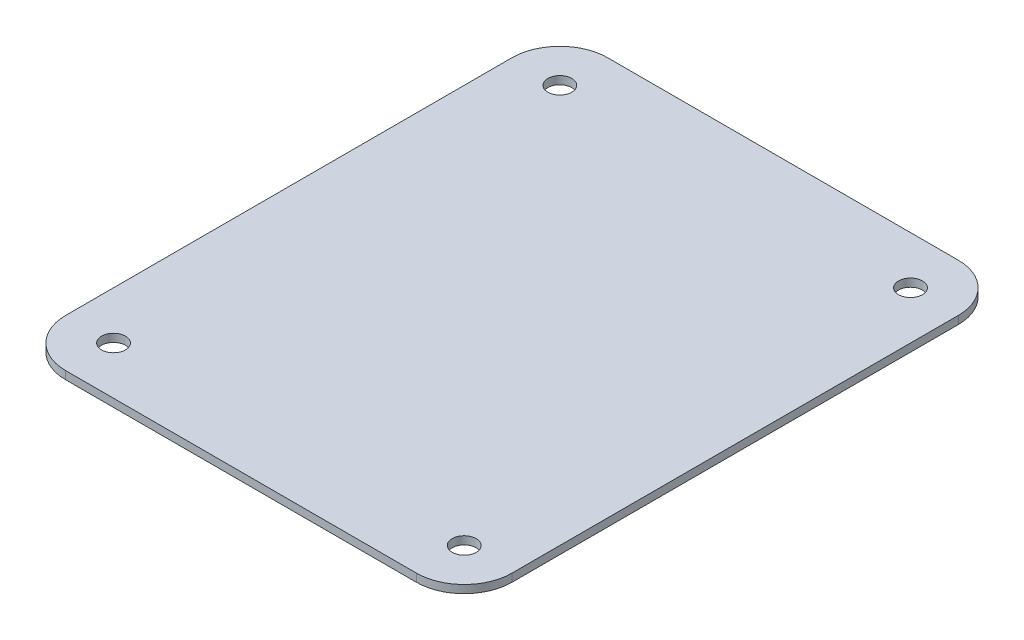
from build123d import *

# Parameters (mm, degrees)
BASE_FLANGE1_DEPTH = 3.175
SKETCH6_R          = 4.7625
CUT_EXTRUDE1_DEPTH = 140.880281402


# Sheet-metal steps are written as plain solids
with BuildPart() as part:
    # Sketch1 → Base-Flange1 (new body)
    with BuildSketch(Plane(origin=(0, 0, 0), x_dir=(1, 0, 0), z_dir=(0, 1, 0))):
        with BuildLine():
            Line((-69.85, -107.95), (69.85, -107.95))
            ThreePointArc((69.85, -107.95), (83.320384182, -102.370384182), (88.9, -88.9))
            Line((88.9, -88.9), (88.9, 88.9))
            ThreePointArc((88.9, 88.9), (83.320384182, 102.370384182), (69.85, 107.95))
            Line((69.85, 107.95), (-69.85, 107.95))
            ThreePointArc((-69.85, 107.95), (-83.320384182, 102.370384182), (-88.9, 88.9))
            Line((-88.9, 88.9), (-88.9, -88.9))
            ThreePointArc((-88.9, -88.9), (-83.320384182, -102.370384182), (-69.85, -107.95))
        make_face()
    extrude(amount=-BASE_FLANGE1_DEPTH)

    # Sketch6 → Cut-Extrude1 (cut, through all)
    with BuildSketch(Plane(origin=(0, 0, 0), x_dir=(1, 0, 0), z_dir=(0, 1, 0))):
        with Locations(Location((-69.85, -88.9, 0), (0, 0, 270))):
            Circle(SKETCH6_R)
        with Locations(Location((69.85, -88.9, 0), (0, 0, 270))):
            Circle(SKETCH6_R)
        with Locations(Location((69.85, 88.9, 0), (0, 0, 270))):
            Circle(SKETCH6_R)
        with Locations(Location((-69.85, 88.9, 0), (0, 0, 270))):
            Circle(SKETCH6_R)
    extrude(amount=-CUT_EXTRUDE1_DEPTH, mode=Mode.SUBTRACT)


solid = part.part
